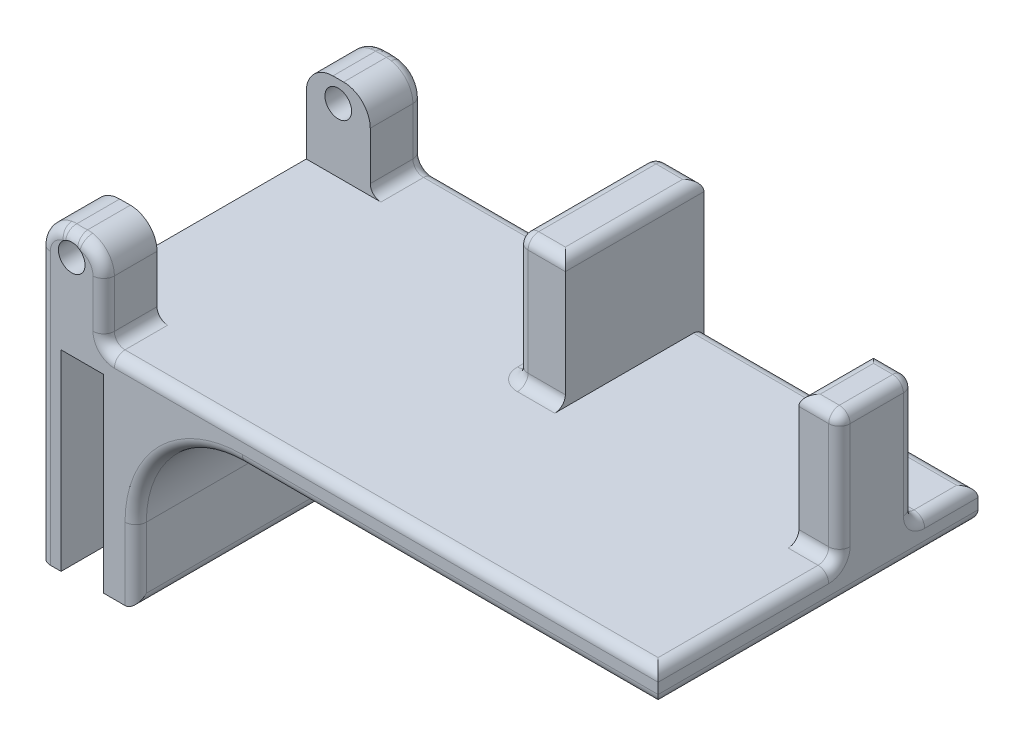
from build123d import *

# Parameters (mm, degrees)
BOSS_EXTRUDE1_DEPTH      = 15
BOSS_EXTRUDE1_DEPTH_BACK = 15
SKETCH1_R                = 1.25
CUT_EXTRUDE1_DEPTH       = 10
CUT_EXTRUDE1_DEPTH_BACK  = 10
SKETCH2_W                = 15.428844934
SKETCH2_H                = 12.075512131
SKETCH3_W                = 4.5
SKETCH3_H                = 13
SKETCH3_W_2              = 3.8
SKETCH3_H_2              = 7
BOSS_EXTRUDE2_DEPTH      = 12
FILLET1_R                = 1


with BuildPart() as part:
    # Sketch1 → Boss-Extrude1 (new, two sides: drawn at the far end of the back side and taken through both)
    with BuildSketch(Plane.XY.offset(-BOSS_EXTRUDE1_DEPTH_BACK)):
        with BuildLine():
            Line((-946.162974387, 278.387338025), (-944.162974387, 278.387338025))
            Line((-944.162974387, 278.387338025), (-944.162974387, 296.387338025))
            Line((-944.162974387, 296.387338025), (-940.162974387, 296.387338025))
            Line((-940.162974387, 296.387338025), (-940.162974387, 278.613618092))
            Line((-940.162974387, 278.613618092), (-937.162974387, 278.613618092))
            Line((-937.162974387, 278.613618092), (-937.162974387, 285.387338025))
            ThreePointArc((-937.162974387, 285.387338025), (-934.234042199, 292.458405837), (-927.162974387, 295.387338025))
            Line((-927.162974387, 295.387338025), (-888.162974387, 295.387338025))
            Line((-888.162974387, 295.387338025), (-888.162974387, 298.387338025))
            Line((-888.162974387, 298.387338025), (-940.162974387, 298.387338025))
            Line((-940.162974387, 298.387338025), (-940.162974387, 303.887338025))
            ThreePointArc((-940.162974387, 303.887338025), (-940.895207434, 305.655104978), (-942.662974387, 306.387338025))
            Line((-942.662974387, 306.387338025), (-943.662974387, 306.387338025))
            ThreePointArc((-943.662974387, 306.387338025), (-945.43074134, 305.655104978), (-946.162974387, 303.887338025))
            Line((-946.162974387, 303.887338025), (-946.162974387, 298.387338025))
            Line((-946.162974387, 298.387338025), (-946.162974387, 278.387338025))
        make_face()
        with Locations((-943.162974387, 304.387338025)):
            Circle(SKETCH1_R, mode=Mode.SUBTRACT)
    extrude(amount=BOSS_EXTRUDE1_DEPTH + BOSS_EXTRUDE1_DEPTH_BACK)

    # Sketch2 → Cut-Extrude1 (cut, two sides: drawn at the far end of the back side and taken through both)
    with BuildSketch(Plane.XY.offset(-CUT_EXTRUDE1_DEPTH_BACK)):
        with Locations((-947.877396854, 304.425094091)):
            Rectangle(SKETCH2_W, SKETCH2_H)
    extrude(amount=CUT_EXTRUDE1_DEPTH + CUT_EXTRUDE1_DEPTH_BACK, mode=Mode.SUBTRACT)

    # Sketch3 → Boss-Extrude2 (add)
    with BuildSketch(Plane(origin=(0, 298.387338025, 0), x_dir=(1, 0, 0), z_dir=(0, 1, 0))):
        with Locations((-916.112974387, 8.5)):
            Rectangle(SKETCH3_W, SKETCH3_H)
        with Locations((-890.062974387, 5.5)):
            Rectangle(SKETCH3_W_2, SKETCH3_H_2)
    extrude(amount=BOSS_EXTRUDE2_DEPTH)

    # Fillet1
    fillet1_edges = [part.edges().sort_by_distance(p)[0] for p in [
        (-946.162974387, 291.137338025, -15),
        (-946.162974387, 291.137338025, 15),
        (-945.43074134, 305.655104978, -15),
        (-945.43074134, 305.655104978, 15),
        (-940.895207434, 305.655104978, -15),
        (-940.895207434, 305.655104978, 15),
        (-940.162974387, 301.137338025, -15),
        (-940.162974387, 301.137338025, 15),
        (-929.262974387, 298.387338025, -15),
        (-916.112974387, 298.387338025, -2),
        (-934.234042199, 292.458405837, -15),
        (-934.234042199, 292.458405837, 15),
        (-937.162974387, 282.000478059, -15),
        (-937.162974387, 278.613618092, 0),
        (-937.162974387, 282.000478059, 15),
        (-907.662974387, 295.387338025, -15),
        (-907.662974387, 295.387338025, 15),
        (-888.162974387, 295.387338025, 0),
        (-916.112974387, 310.387338025, -2),
        (-918.362974387, 310.387338025, -8.5),
        (-916.112974387, 310.387338025, -15),
        (-913.862974387, 310.387338025, -8.5),
        (-890.062974387, 310.387338025, -9),
        (-888.162974387, 310.387338025, -5.5),
        (-890.062974387, 310.387338025, -2),
        (-891.962974387, 310.387338025, -5.5),
        (-940.162974387, 298.387338025, -12.5),
        (-940.162974387, 298.387338025, 12.5),
        (-890.062974387, 298.387338025, -9),
        (-890.062974387, 298.387338025, -2),
        (-918.362974387, 298.387338025, -8.5),
        (-918.362974387, 304.387338025, -15),
        (-918.362974387, 304.387338025, -2),
        (-888.162974387, 304.387338025, -2),
        (-888.162974387, 304.387338025, -9),
        (-901.012974387, 298.387338025, -15),
        (-888.162974387, 298.387338025, -12),
        (-888.162974387, 298.387338025, 6.5),
        (-914.162974387, 298.387338025, 15),
    ]]
    fillet(fillet1_edges, radius=FILLET1_R)


solid = part.part
